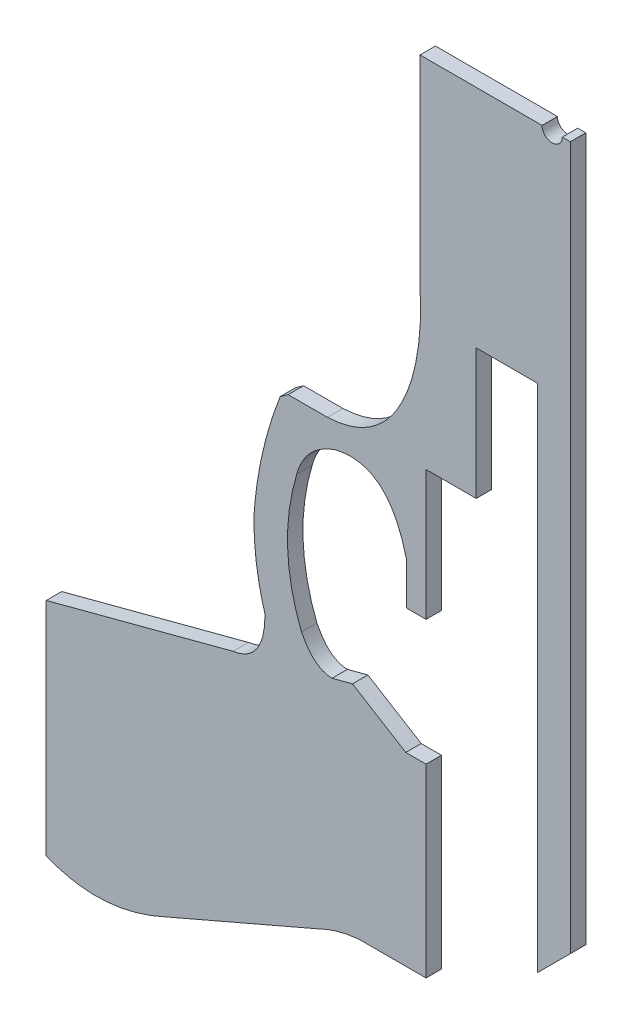
from build123d import *

# Parameters (mm, degrees)
BOSS_EXTRUDE2_DEPTH = 30


with BuildPart() as part:
    # Sketch1 → Boss-Extrude2 (new body)
    with BuildSketch(Plane.XY):
        with BuildLine():
            Line((1031.502635869, 1150.948032453), (954.91997963, 1150.948032453))
            Line((954.91997963, 1150.948032453), (939.420503598, 1139.998861311))
            add(Edge.make_bspline(
                [(939.420503598, 1139.998861311), (896.114943223, 1029.500043353), (888.389925254, 913.708929665)],
                knots=[0, 0, 0, 1, 1, 1], degree=2))
            add(Edge.make_bspline(
                [(888.389925254, 913.708929665), (887.186978882, 833.476122228), (909.965440736, 758.433499294)],
                knots=[0, 0, 0, 1, 1, 1], degree=2))
            add(Edge.make_bspline(
                [(909.965440736, 758.433499294), (909.662851355, 673.931051759), (847.862737291, 664.845833929)],
                knots=[0, 0, 0, 1, 1, 1], degree=2))
            Line((847.862737291, 664.845833929), (484.203808265, 568.782480704))
            Line((484.203808265, 568.782480704), (484.203808265, 138.33790498))
            add(Edge.make_bspline(
                [(719.139339578, 152.809543522), (593.118985298, 93.530649751), (484.203808265, 138.33790498)],
                knots=[0, 0, 0, 1, 1, 1], degree=2))
            Line((719.139339578, 152.809543522), (1015.90547259, 281.027298047))
            add(Edge.make_bspline(
                [(1092.940902472, 302.080899103), (1051.708929691, 298.652633533), (1015.90547259, 281.027298047)],
                knots=[0, 0, 0, 0.968347313, 0.968347313, 0.968347313], degree=2))
            Line((1092.940902472, 302.080899103), (1223.250784929, 302.080899103))
            Line((1223.250784929, 302.080899103), (1223.250784929, 662.443079758))
            Line((1223.250784929, 662.443079758), (1183.847821391, 662.443079758))
            Line((1183.847821391, 662.443079758), (1080.143197821, 726.204536125))
            Line((1080.143197821, 726.204536125), (1040.274844053, 715.672998344))
            add(Edge.make_bspline(
                [(980.866305397, 763.899022355), (1005.441675542, 715.934451565), (1040.274844053, 715.672998344)],
                knots=[0, 0, 0, 0.703910584, 0.703910584, 0.703910584], degree=2))
            add(Edge.make_bspline(
                [(971.742729775, 1025.667621279), (931.4355252, 890.500779369), (980.866305397, 763.899022355)],
                knots=[0, 0, 0, 1, 1, 1], degree=2))
            add(Edge.make_bspline(
                [(1045.703498702, 1103.594613103), (987.89689879, 1083.60417477), (971.742729775, 1025.667621279)],
                knots=[0, 0, 0, 1, 1, 1], degree=2))
            add(Edge.make_bspline(
                [(1184.911351774, 989.603955607), (1150.253532092, 1129.368452684), (1045.703498702, 1103.594613103)],
                knots=[0, 0, 0, 1, 1, 1], degree=2))
            Line((1184.911351774, 989.603955607), (1184.911351774, 906.399810778))
            Line((1184.911351774, 906.399810778), (1223.250784929, 906.399810778))
            Line((1223.250784929, 906.399810778), (1223.250784929, 1158.935473883))
            Line((1223.250784929, 1158.935473883), (1320.873772245, 1158.935473883))
            Line((1320.873772245, 1158.935473883), (1320.873772245, 1412.680536155))
            Line((1320.873772245, 1412.680536155), (1440.180651506, 1412.680536155))
            Line((1440.180651506, 1412.680536155), (1440.180651506, 419.600470559))
            Line((1440.180651506, 419.600470559), (1504.026707651, 483.446526704))
            Line((1504.026707651, 483.446526704), (1504.026707651, 1851.665681924))
            Line((1504.026707651, 1851.665681924), (1488.30649751, 1851.665681924))
            ThreePointArc((1488.30649751, 1851.665681924), (1468.608083397, 1831.967267812), (1448.909669284, 1851.665681924))
            Line((1448.909669284, 1851.665681924), (1211.440078377, 1851.665681924))
            Line((1211.440078377, 1851.665681924), (1211.440078377, 1458.457868447))
            add(Edge.make_bspline(
                [(1211.440078377, 1458.457868447), (1219.968347696, 1335.133658845), (1184.334370782, 1157.066614371), (1031.502635869, 1150.948032453)],
                knots=[0.823969697, 0.823969697, 0.823969697, 0.823969697, 1.823969697, 1.823969697, 1.823969697, 1.823969697], degree=3))
        make_face()
    extrude(amount=BOSS_EXTRUDE2_DEPTH)


solid = part.part
